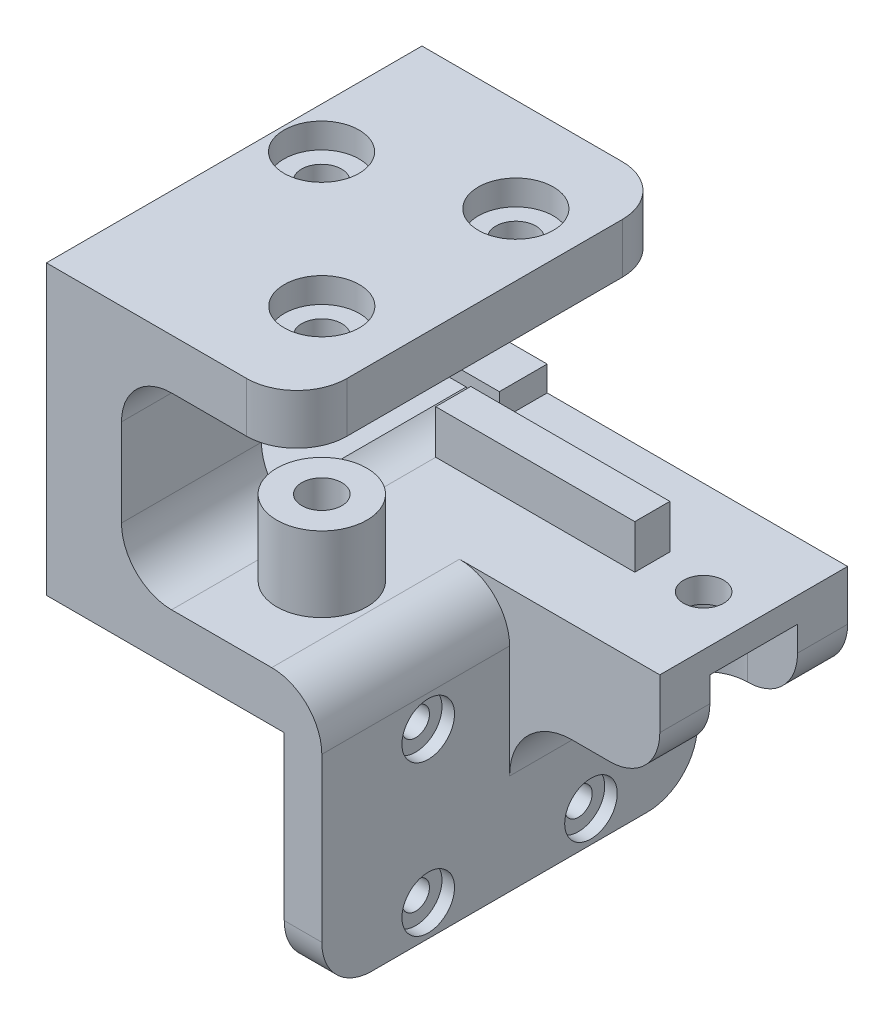
from build123d import *
from build123d.topology import SkipClean

# Parameters (mm, degrees)
RESSALTO_EXTRUS_O1_DEPTH      = 30
CORTE_EXTRUS_O1_DEPTH         = 54.488316481
CORTE_EXTRUS_O1_DEPTH_BACK    = 54.488316481
ESBO_O3_R                     = 1.1
CORTE_EXTRUS_O6_DEPTH         = 54.488316481
CORTE_EXTRUS_O6_DEPTH_BACK    = 54.488316481
ESBO_O4_W                     = 12
ESBO_O4_H                     = 15
ESBO_O5_R                     = 1.6
CORTE_EXTRUS_O7_DEPTH         = 54.488316481
CORTE_EXTRUS_O9_START         = 1
ESBO_O7_W                     = 15
ESBO_O7_H                     = 15
CORTE_EXTRUS_O9_DEPTH         = 8
CORTE_EXTRUS_O11_REACH        = 55.488
ESBO_O9_R                     = 1.6
ESBO_O8_R                     = 3
CORTE_EXTRUS_O10_DEPTH        = 2
CORTE_EXTRUS_O14_DEPTH        = 43.308391603
CORTE_EXTRUS_O14_DEPTH_BACK   = 2
CORTE_EXTRUS_O16_DEPTH        = 55.626001135
CORTE_EXTRUS_O16_DEPTH_BACK   = 1
ESBO_O15_R                    = 2.1
FILETE1_R                     = 4
ESBO_O16_W                    = 10
ESBO_O16_H                    = 3.82
RESSALTO_EXTRUS_O2_DEPTH      = 2
ESBO_O17_W                    = 15.9
ESBO_O17_H                    = 2.8
RESSALTO_EXTRUS_O3_DEPTH      = 3.5
RESSALTO_EXTRUS_O4_DEPTH      = 6
RESSALTO_EXTRUS_O4_DEPTH_BACK = 1
ESBO_O20_R                    = 3.6
ESBO_O20_R_2                  = 1.6


with BuildPart() as part:
    # Esboço1 → Ressalto-extrusão1 (new body)
    with BuildSketch(Plane.XY):
        with BuildLine():
            Line((0, 0), (3, 0))
            Line((3, 0), (3, 8))
            ThreePointArc((3, 8), (4.464466094, 11.535533906), (8, 13))
            Line((8, 13), (15, 13))
            Line((15, 13), (15, 21))
            Line((15, 21), (-13, 21))
            Line((-13, 21), (-13, 36))
            Line((-13, 36), (1, 36))
            Line((1, 36), (1, 40))
            Line((1, 40), (-19, 40))
            Line((-19, 40), (-19, 17))
            Line((-19, 17), (0, 17))
            Line((0, 17), (0, 0))
        make_face()
    extrude(amount=RESSALTO_EXTRUS_O1_DEPTH)

    # Esboço3 → Corte-extrusão1 (cut, two sides: drawn at the far end of the back side and taken through both)
    with BuildSketch(Plane(origin=(0, 0, 0), x_dir=(0, 0, -1), z_dir=(1, 0, 0)).offset(-CORTE_EXTRUS_O1_DEPTH_BACK)):
        with Locations((-8.5, 14.5)):
            Circle(ESBO_O3_R)
        with Locations(Location((-21.5, 14.5, 0), (0, 0, 90))):
            Circle(ESBO_O3_R)
        with Locations(Location((-8.5, 2.5, 0), (0, 0, 90))):
            Circle(ESBO_O3_R)
        with Locations(Location((-21.5, 2.5, 0), (0, 0, 90))):
            Circle(ESBO_O3_R)
    extrude(amount=CORTE_EXTRUS_O1_DEPTH + CORTE_EXTRUS_O1_DEPTH_BACK, mode=Mode.SUBTRACT)

    # Esboço4 → Corte-extrusão6 (cut, two sides: drawn at the far end of the back side and taken through both)
    with BuildSketch(Plane(origin=(0, 0, 0), x_dir=(1, 0, 0), z_dir=(0, 1, 0)).offset(-CORTE_EXTRUS_O6_DEPTH_BACK)):
        with Locations((9, -22.5)):
            Rectangle(ESBO_O4_W, ESBO_O4_H)
    extrude(amount=CORTE_EXTRUS_O6_DEPTH + CORTE_EXTRUS_O6_DEPTH_BACK, mode=Mode.SUBTRACT)

    # Esboço5 → Corte-extrusão7 (cut, through all)
    with BuildSketch(Plane(origin=(0, 40, 0), x_dir=(1, 0, 0), z_dir=(0, 1, 0))):
        with Locations(Location((-5, -22, 0), (0, 0, 270))):
            Circle(ESBO_O5_R)
        with Locations(Location((-15.7, -11.32, 0), (0, 0, 180))):
            Circle(ESBO_O5_R)
        with Locations(Location((11, -7.5, 0), (0, 0, 180))):
            Circle(ESBO_O5_R)
    extrude(amount=-CORTE_EXTRUS_O7_DEPTH, mode=Mode.SUBTRACT)

    # Esboço7 → Corte-extrusão9 (cut)
    with BuildSketch(Plane(origin=(0, 21, 0), x_dir=(1, 0, 0), z_dir=(0, 1, 0)).offset(CORTE_EXTRUS_O9_START)):
        with Locations((-15.7, -11.32)):
            Rectangle(ESBO_O7_W, ESBO_O7_H)
    extrude(amount=CORTE_EXTRUS_O9_DEPTH, mode=Mode.SUBTRACT)

    # Esboço9 → Corte-extrusão11 (cut, up to next)
    with BuildSketch(Plane(origin=(0, 40, 0), x_dir=(1, 0, 0), z_dir=(0, 1, 0)), mode=Mode.PRIVATE) as corte_extrus_o11_sk1:
        with Locations(Location((-4, -7.5, 0), (0, 0, 180))):
            Circle(ESBO_O9_R)
    corte_extrus_o11_tool1 = extrude(corte_extrus_o11_sk1.sketch, amount=-CORTE_EXTRUS_O11_REACH, mode=Mode.PRIVATE) & part.part
    add(corte_extrus_o11_tool1.solids().sort_by_distance((-4, 40, 7.5))[0], mode=Mode.SUBTRACT)

    # Esboço8 → Corte-extrusão10 (cut)
    with BuildSketch(Plane(origin=(0, 40, 0), x_dir=(1, 0, 0), z_dir=(0, 1, 0))):
        with Locations(Location((-15.7, -11.32, 0), (0, 0, 180))):
            Circle(ESBO_O8_R)
        with Locations(Location((-5, -22, 0), (0, 0, 180))):
            Circle(ESBO_O8_R)
        with Locations(Location((-4, -7.5, 0), (0, 0, 180))):
            Circle(ESBO_O8_R)
    extrude(amount=-CORTE_EXTRUS_O10_DEPTH, mode=Mode.SUBTRACT)

    # Esboço14 → Corte-extrusão14 (cut, two sides: drawn at the far end of the back side and taken through both)
    with BuildSketch(Plane.XZ.offset(-17).offset(-CORTE_EXTRUS_O14_DEPTH_BACK)):
        with BuildLine():
            Line((11, 11), (15, 11))
            Line((15, 11), (15, 4))
            Line((15, 4), (11, 4))
            ThreePointArc((11, 4), (7.5, 7.5), (11, 11))
        make_face()
        Polygon((-5, 25.233161507), (-7.8, 23.616580754), (-7.8, 20.383419246), (-5, 18.766838493), (-2.2, 20.383419246), (-2.2, 23.616580754), align=None)
        Polygon((-15.7, 14.553161507), (-18.5, 12.936580754), (-18.5, 9.703419246), (-15.7, 8.086838493), (-12.9, 9.703419246), (-12.9, 12.936580754), align=None)
    extrude(amount=CORTE_EXTRUS_O14_DEPTH + CORTE_EXTRUS_O14_DEPTH_BACK, mode=Mode.SUBTRACT)

    # Esboço15 → Corte-extrusão16 (cut, two sides: drawn at the far end of the back side and taken through both)
    with BuildSketch(Plane(origin=(3, 0, 0), x_dir=(0, 0, -1), z_dir=(1, 0, 0)).offset(-CORTE_EXTRUS_O16_DEPTH_BACK)):
        with Locations(Location((-21.5, 14.5, 0), (0, 0, 90))):
            Circle(ESBO_O15_R)
        with Locations(Location((-8.5, 14.5, 0), (0, 0, 313.540252108))):
            Circle(ESBO_O15_R)
        with Locations(Location((-8.5, 2.5, 0), (0, 0, 90))):
            Circle(ESBO_O15_R)
        with Locations(Location((-21.5, 2.5, 0), (0, 0, 90))):
            Circle(ESBO_O15_R)
    extrude(amount=CORTE_EXTRUS_O16_DEPTH + CORTE_EXTRUS_O16_DEPTH_BACK, mode=Mode.SUBTRACT)

    # Filete1
    # the kernel refuses this fillet: 4 mm, written as the material it adds along each edge
    with BuildSketch(Plane(origin=(-13, 21, 0), x_dir=(1, 0, 0), z_dir=(0, 0, 1))) as filete1_piece_1_section:
        with BuildLine():
            CenterArc((FILETE1_R, FILETE1_R), FILETE1_R, 180, 90)
            Line((0, FILETE1_R), (0, 0))
            Line((0, 0), (FILETE1_R, 0))
        make_face()
    filete1_piece_1 = extrude(amount=30, mode=Mode.PRIVATE)
    filete1_piece_1 = split(filete1_piece_1, bisect_by=Plane(origin=(-11.759467995, 21.365337359, 3.82), z_dir=(0, 0, -1)), keep=Keep.TOP, mode=Mode.PRIVATE)
    filete1_piece_1 = split(filete1_piece_1, bisect_by=Plane(origin=(-11.759467995, 22, 1.91), z_dir=(0, -1, 0)), keep=Keep.TOP, mode=Mode.PRIVATE)
    add(filete1_piece_1)
    with BuildSketch(Plane(origin=(-13, 21, 0), x_dir=(1, 0, 0), z_dir=(0, 0, 1))) as filete1_piece_2_section:
        with BuildLine():
            CenterArc((FILETE1_R, FILETE1_R), FILETE1_R, 180, 90)
            Line((0, FILETE1_R), (0, 0))
            Line((0, 0), (FILETE1_R, 0))
        make_face()
    filete1_piece_2 = extrude(amount=30, mode=Mode.PRIVATE)
    filete1_piece_2 = split(filete1_piece_2, bisect_by=Plane(origin=(-12.678584174, 22.84777915, 3.82), z_dir=(0, 0, -1)), keep=Keep.TOP, mode=Mode.PRIVATE)
    filete1_piece_2 = split(filete1_piece_2, bisect_by=Plane(origin=(-12.678584174, 22, 1.91), z_dir=(0, 1, 0)), keep=Keep.TOP, mode=Mode.PRIVATE)
    add(filete1_piece_2)
    with BuildSketch(Plane(origin=(-13, 21, 0), x_dir=(1, 0, 0), z_dir=(0, 0, 1))) as filete1_piece_3_section:
        with BuildLine():
            CenterArc((FILETE1_R, FILETE1_R), FILETE1_R, 180, 90)
            Line((0, FILETE1_R), (0, 0))
            Line((0, 0), (FILETE1_R, 0))
        make_face()
    filete1_piece_3 = extrude(amount=30, mode=Mode.PRIVATE)
    filete1_piece_3 = split(filete1_piece_3, bisect_by=Plane(origin=(-11.759467995, 21.365337359, 3.82), z_dir=(0, 0, 1)), keep=Keep.TOP, mode=Mode.PRIVATE)
    filete1_piece_3 = split(filete1_piece_3, bisect_by=Plane(origin=(-11.759467995, 22, 11.32), z_dir=(0, -1, 0)), keep=Keep.TOP, mode=Mode.PRIVATE)
    filete1_piece_3 = split(filete1_piece_3, bisect_by=Plane(origin=(-11.759467995, 21.365337359, 18.82), z_dir=(0, 0, -1)), keep=Keep.TOP, mode=Mode.PRIVATE)
    add(filete1_piece_3)
    with BuildSketch(Plane(origin=(-13, 21, 0), x_dir=(1, 0, 0), z_dir=(0, 0, 1))) as filete1_piece_4_section:
        with BuildLine():
            CenterArc((FILETE1_R, FILETE1_R), FILETE1_R, 180, 90)
            Line((0, FILETE1_R), (0, 0))
            Line((0, 0), (FILETE1_R, 0))
        make_face()
    filete1_piece_4 = extrude(amount=30, mode=Mode.PRIVATE)
    filete1_piece_4 = split(filete1_piece_4, bisect_by=Plane(origin=(-11.759467995, 22, 24.41), z_dir=(0, -1, 0)), keep=Keep.TOP, mode=Mode.PRIVATE)
    filete1_piece_4 = split(filete1_piece_4, bisect_by=Plane(origin=(-11.759467995, 21.365337359, 18.82), z_dir=(0, 0, 1)), keep=Keep.TOP, mode=Mode.PRIVATE)
    add(filete1_piece_4)
    with BuildSketch(Plane(origin=(-13, 21, 0), x_dir=(1, 0, 0), z_dir=(0, 0, 1))) as filete1_piece_5_section:
        with BuildLine():
            CenterArc((FILETE1_R, FILETE1_R), FILETE1_R, 180, 90)
            Line((0, FILETE1_R), (0, 0))
            Line((0, 0), (FILETE1_R, 0))
        make_face()
    filete1_piece_5 = extrude(amount=30, mode=Mode.PRIVATE)
    filete1_piece_5 = split(filete1_piece_5, bisect_by=Plane(origin=(-12.678584174, 22, 24.41), z_dir=(0, 1, 0)), keep=Keep.TOP, mode=Mode.PRIVATE)
    filete1_piece_5 = split(filete1_piece_5, bisect_by=Plane(origin=(-12.678584174, 22.84777915, 18.82), z_dir=(0, 0, 1)), keep=Keep.TOP, mode=Mode.PRIVATE)
    add(filete1_piece_5)
    with BuildSketch(Plane(origin=(-13, 36, 0), x_dir=(1, 0, 0), z_dir=(0, 0, 1))) as filete1_piece_6:
        with BuildLine():
            CenterArc((FILETE1_R, -FILETE1_R), FILETE1_R, 90, 90)
            Line((0, -FILETE1_R), (0, 0))
            Line((0, 0), (FILETE1_R, 0))
        make_face()
    extrude(amount=30)
    # the kernel refuses this fillet: 4 mm, written as the material it takes off along each edge
    with BuildSketch(Plane(origin=(-10, 0, 0), x_dir=(0, 0, 1), z_dir=(1, 0, 0))) as filete1_2_piece_1:
        with BuildLine():
            CenterArc((FILETE1_R, -FILETE1_R), FILETE1_R, 90, 90)
            Line((0, -FILETE1_R), (0, 0))
            Line((0, 0), (FILETE1_R, 0))
        make_face()
    extrude(amount=23, mode=Mode.SUBTRACT)
    with BuildSketch(Plane(origin=(-10, 0, 30), x_dir=(0, 0, -1), z_dir=(1, 0, 0))) as filete1_2_piece_2:
        with BuildLine():
            CenterArc((FILETE1_R, FILETE1_R), FILETE1_R, 180, 90)
            Line((0, FILETE1_R), (0, 0))
            Line((0, 0), (FILETE1_R, 0))
        make_face()
    extrude(amount=23, mode=Mode.SUBTRACT)
    with BuildSketch(Plane(origin=(3, 21, 15), x_dir=(-1, 0, 0), z_dir=(0, 0, 1))) as filete1_2_piece_3:
        with BuildLine():
            CenterArc((FILETE1_R, FILETE1_R), FILETE1_R, 180, 90)
            Line((0, FILETE1_R), (0, 0))
            Line((0, 0), (FILETE1_R, 0))
        make_face()
    extrude(amount=25, mode=Mode.SUBTRACT)
    with BuildSketch(Plane(origin=(1, 26, 0), x_dir=(0, 0, 1), z_dir=(0, 1, 0)), Plane(origin=(15, 13, -10), x_dir=(-1, 0, 0), z_dir=(0, 0, 1)), Plane(origin=(15, 13, 1), x_dir=(-1, 0, 0), z_dir=(0, 0, 1)), Plane(origin=(1, 26, 30), x_dir=(-1, 0, 0), z_dir=(0, 1, 0))) as filete1_2_piece_4:
        with BuildLine():
            CenterArc((FILETE1_R, -FILETE1_R), FILETE1_R, 90, 90)
            Line((0, -FILETE1_R), (0, 0))
            Line((0, 0), (FILETE1_R, 0))
        make_face()
    extrude(amount=24, mode=Mode.SUBTRACT)

    # Esboço16 → Ressalto-extrusão2 (add)
    with BuildSketch(Plane(origin=(0, 21, 0), x_dir=(1, 0, 0), z_dir=(0, 1, 0))):
        with Locations((-14, -1.91)):
            Rectangle(ESBO_O16_W, ESBO_O16_H)
    extrude(amount=RESSALTO_EXTRUS_O2_DEPTH)

    # Esboço17 → Ressalto-extrusão3 (add)
    with BuildSketch(Plane(origin=(0, 21, 0), x_dir=(1, 0, 0), z_dir=(0, 1, 0))):
        with Locations((-1.05, -7.5)):
            Rectangle(ESBO_O17_W, ESBO_O17_H)
    extrude(amount=RESSALTO_EXTRUS_O3_DEPTH)

    # Esboço20 → Ressalto-extrusão4 (add, two sides: drawn at the far end of the back side and taken through both)
    with SkipClean():  # the faces are left unmerged after this step: merging them gives an invalid solid
        with BuildSketch(Plane(origin=(0, 21, 0), x_dir=(1, 0, 0), z_dir=(0, 1, 0)).offset(-RESSALTO_EXTRUS_O4_DEPTH_BACK)):
            with Locations((-5, -22)):
                Circle(ESBO_O20_R)
            with Locations(Location((-5, -22, 0), (0, 0, 180))):
                Circle(ESBO_O20_R_2, mode=Mode.SUBTRACT)
        extrude(amount=RESSALTO_EXTRUS_O4_DEPTH + RESSALTO_EXTRUS_O4_DEPTH_BACK)


solid = part.part
